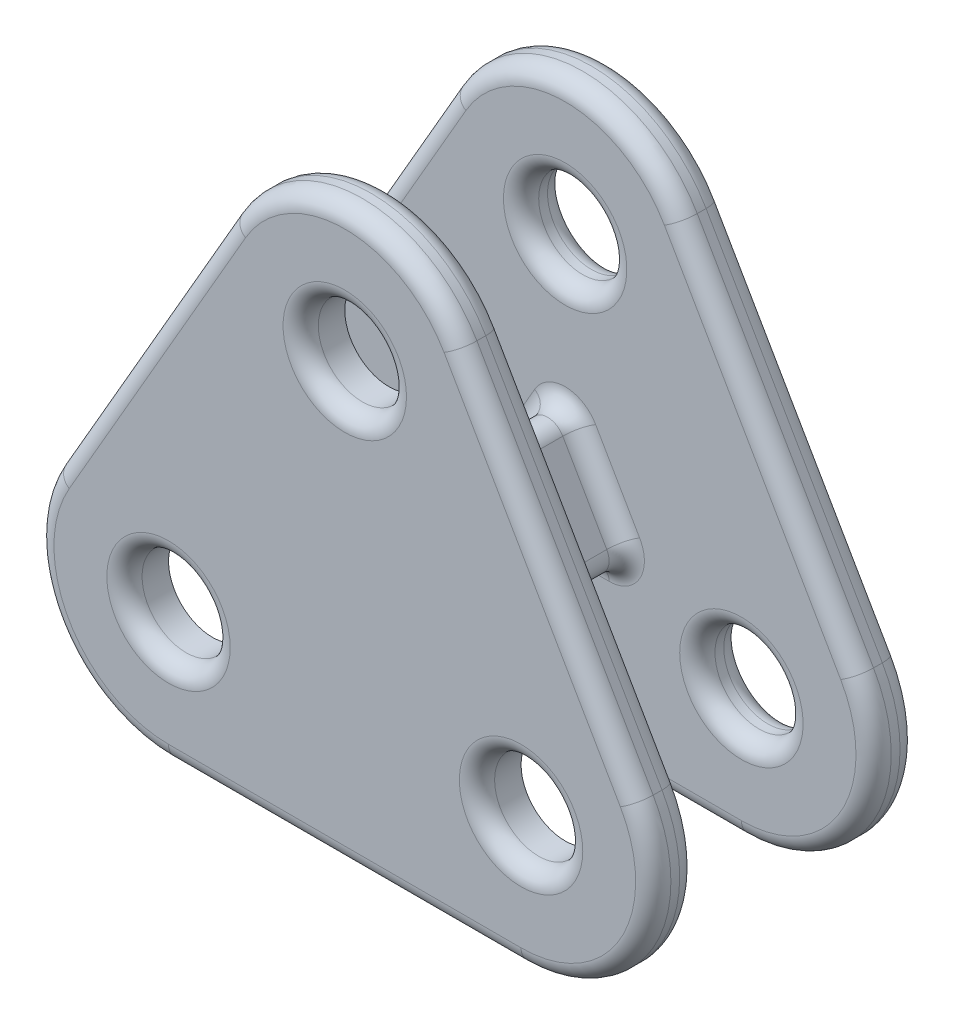
from build123d import *

# Parameters (mm, degrees)
SKETCH1_R               = 3.175
BOSS_EXTRUDE1_DEPTH     = 19.05
FILLET1_R               = 1.27
CUT_EXTRUDE1_START      = -4.7625
CUT_EXTRUDE1_OUTLINE_W  = 47
CUT_EXTRUDE1_OUTLINE_H  = 12.7
CUT_EXTRUDE1_DEPTH      = 14.2875
CUT_EXTRUDE2_START      = 3.175
CUT_EXTRUDE2_OUTLINE_R  = 3.175
CUT_EXTRUDE2_DEPTH      = 12.7
CUT_EXTRUDE3_DEPTH      = 51.757240559
CUT_EXTRUDE3_DEPTH_BACK = 51.757240559
SKETCH4_W               = 12.7
SKETCH4_H               = 12.7
FILLET2_R               = 1.27


# Read off the part's stored shape, not the designer's step: Cut-Extrude1, Cut-Extrude2
with BuildPart() as part:
    # Sketch1 → Boss-Extrude1 (new body)
    with BuildSketch(Plane.XY):
        with BuildLine():
            Line((-20.948891971, 26.759545256), (-33.648891971, 4.7625))
            ThreePointArc((-33.648891971, 4.7625), (-33.648891971, -4.7625), (-25.4, -9.525))
            Line((-25.4, -9.525), (0, -9.525))
            ThreePointArc((0, -9.525), (8.248891971, -4.7625), (8.248891971, 4.7625))
            Line((8.248891971, 4.7625), (-4.451108029, 26.759545256))
            ThreePointArc((-4.451108029, 26.759545256), (-12.7, 31.522045256), (-20.948891971, 26.759545256))
        make_face()
        with Locations(Location((-25.4, 0, 0), (0, 0, 180))):
            Circle(SKETCH1_R, mode=Mode.SUBTRACT)
        with Locations(Location((0, 0, 0), (0, 0, 180))):
            Circle(SKETCH1_R, mode=Mode.SUBTRACT)
        with Locations(Location((-12.7, 21.997045256, 0), (0, 0, 180))):
            Circle(SKETCH1_R, mode=Mode.SUBTRACT)
    extrude(amount=BOSS_EXTRUDE1_DEPTH)

    # Fillet1
    fillet1_edges = [part.edges().sort_by_distance(p)[0] for p in [
        (8.248891971, -4.7625, 19.05),
        (1.898891971, 15.761022628, 19.05),
        (-12.7, 31.522045256, 19.05),
        (-27.298891971, 15.761022628, 19.05),
        (-33.648891971, -4.7625, 19.05),
        (-27.298891971, 15.761022628, 0),
        (-12.7, 31.522045256, 0),
        (1.898891971, 15.761022628, 0),
        (8.248891971, -4.7625, 0),
        (-12.7, -9.525, 0),
        (-33.648891971, -4.7625, 0),
        (-12.7, -9.525, 19.05),
    ]]
    fillet(fillet1_edges, radius=FILLET1_R)

    # Cut-Extrude1 outline → Cut-Extrude1 (cut)
    with BuildSketch(Plane(origin=(0, 0, 0), x_dir=(0.500000000000004, -0.8660254037844363, 0), z_dir=(0.8660254037844363, 0.5000000000000042, 0)).offset(CUT_EXTRUDE1_START)):
        with Locations((-12.5, -9.525)):
            Rectangle(CUT_EXTRUDE1_OUTLINE_W, CUT_EXTRUDE1_OUTLINE_H)
    extrude(amount=CUT_EXTRUDE1_DEPTH, mode=Mode.SUBTRACT)

    # Cut-Extrude2 outline → Cut-Extrude2 (cut)
    with BuildSketch(Plane.XY.offset(CUT_EXTRUDE2_START)):
        with BuildLine():
            ThreePointArc((-33.648891971, 4.7625), (-33.648891971, -4.7625), (-25.4, -9.525))
            Line((-25.4, -9.525), (-12.7, 12.472045256))
            Line((-12.7, 12.472045256), (-20.948891971, 26.759545256))
            Line((-20.948891971, 26.759545256), (-33.648891971, 4.7625))
        make_face()
        with Locations((-25.4, 0)):
            Circle(CUT_EXTRUDE2_OUTLINE_R, mode=Mode.SUBTRACT)
    extrude(amount=CUT_EXTRUDE2_DEPTH, mode=Mode.SUBTRACT)

    # Sketch4 → Cut-Extrude3 (cut, two sides: drawn at the far end of the back side and taken through both)
    with BuildSketch(Plane(origin=(-25.4, 0, 0), x_dir=(0, 0, -1), z_dir=(1, 0, 0)).offset(-CUT_EXTRUDE3_DEPTH_BACK)):
        with Locations((-9.525, -3.175)):
            Rectangle(SKETCH4_W, SKETCH4_H)
    extrude(amount=CUT_EXTRUDE3_DEPTH + CUT_EXTRUDE3_DEPTH_BACK, mode=Mode.SUBTRACT)

    # Fillet2
    fillet2_edges = [part.edges().sort_by_distance(p)[0] for p in [
        (-22.225, 0, 3.175),
        (-15.383825791, 7.823522628, 3.175),
        (-33.648891971, -4.7625, 3.175),
        (-27.298891971, 15.761022628, 3.175),
        (-27.298891971, 15.761022628, 15.875),
        (-33.648891971, -4.7625, 15.875),
        (-15.383825791, 7.823522628, 15.875),
        (-12.7, 12.472045256, 9.525),
        (-18.067651581, 3.175, 9.525),
        (-12.7, 3.175, 15.875),
        (-7.332348419, 3.175, 9.525),
        (-12.7, 3.175, 3.175),
        (-12.7, -9.525, 3.175),
        (-12.7, -9.525, 15.875),
        (-22.225, 0, 0),
        (-22.225, 0, 19.05),
        (3.175, 0, 0),
        (3.175, 0, 19.05),
        (-9.525, 21.997045256, 0),
        (-9.525, 21.997045256, 19.05),
        (8.248891971, -4.7625, 15.875),
        (1.898891971, 15.761022628, 15.875),
        (-12.7, 31.522045256, 15.875),
        (1.898891971, 15.761022628, 3.175),
        (8.248891971, -4.7625, 3.175),
        (-12.7, 31.522045256, 3.175),
        (3.175, 0, 3.175),
        (-9.525, 21.997045256, 3.175),
        (-10.016174209, 7.823522628, 3.175),
        (-10.016174209, 7.823522628, 15.875),
    ]]
    fillet(fillet2_edges, radius=FILLET2_R)


solid = part.part
